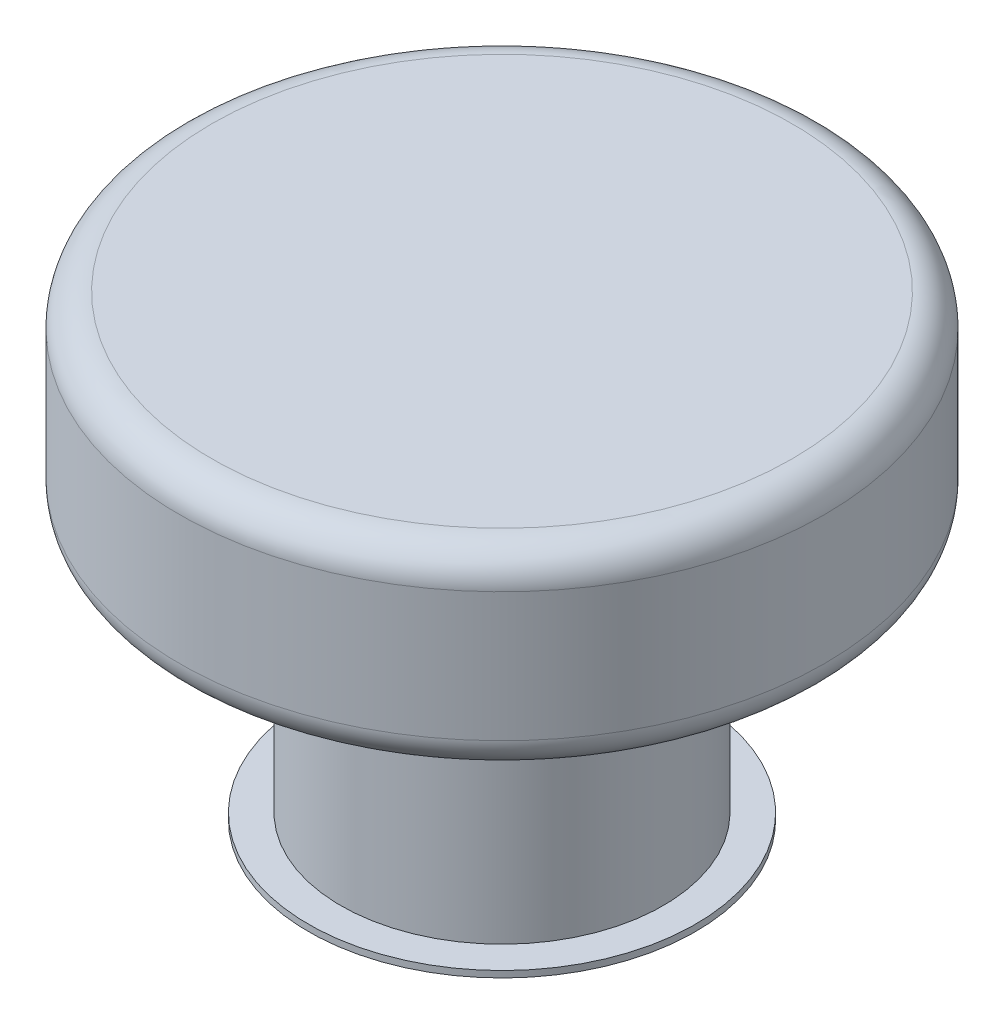
from build123d import *

# Parameters (mm, degrees)
FILLET1_R           = 0.05
SKETCH2_R           = 0.3
BOSS_EXTRUDE1_DEPTH = 0.01


with BuildPart() as part:
    # Sketch1 → Revolve1 (revolve)
    with BuildSketch(Plane.XY):
        Polygon((0, 0), (0.25, 0), (0.25, 0.4), (0.5, 0.4), (0.5, 0.7), (0, 0.7), align=None)
    revolve(axis=Axis((0, 0.7, 0), (0, -1, 0)))

    # Fillet1
    fillet1_edges = [part.edges().sort_by_distance(p)[0] for p in [
        (-0.5, 0.4, 0),
        (-0.5, 0.7, 0),
    ]]
    fillet(fillet1_edges, radius=FILLET1_R)

    # Sketch2 → Boss-Extrude1 (add)
    with BuildSketch(Plane(origin=(0, 0, 0), x_dir=(-1, 0, 0), z_dir=(0, -1, 0))):
        Circle(SKETCH2_R)
    extrude(amount=BOSS_EXTRUDE1_DEPTH)


solid = part.part
